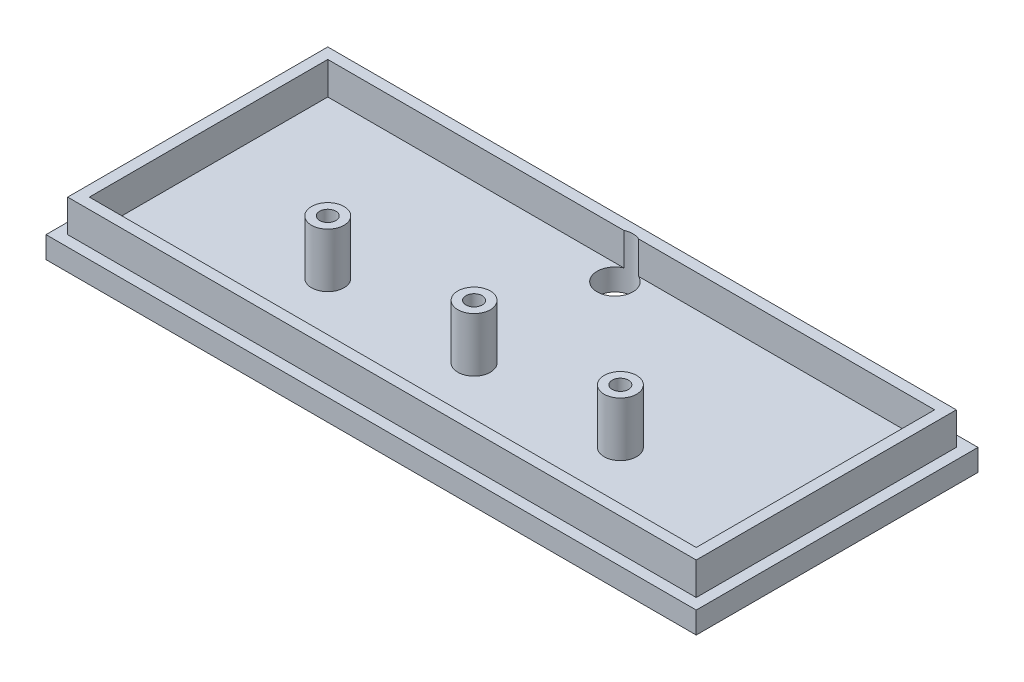
from build123d import *

# Parameters (mm, degrees)
SKETCH1_W                  = 60
SKETCH1_H                  = 26
BOSS_EXTRUDE1_DEPTH        = 2
SKETCH2_W                  = 58
SKETCH2_H                  = 24
SKETCH2_W_2                = 56
SKETCH2_H_2                = 22
BOSS_EXTRUDE2_DEPTH        = 3
SKETCH3_R                  = 1.5
SKETCH3_R_2                = 0.75
BOSS_EXTRUDE3_DEPTH        = 5
F_3_3_3_3_DIAMETER_HOLE1_D = 3.3


with BuildPart() as part:
    # Sketch1 → Boss-Extrude1 (new body)
    with BuildSketch(Plane(origin=(0, 0, 0), x_dir=(1, 0, 0), z_dir=(0, 1, 0))):
        with Locations((30, 13)):
            Rectangle(SKETCH1_W, SKETCH1_H)
    extrude(amount=BOSS_EXTRUDE1_DEPTH)

    # Sketch2 → Boss-Extrude2 (add)
    with BuildSketch(Plane(origin=(0, 2, 0), x_dir=(1, 0, 0), z_dir=(0, 1, 0))):
        with Locations((30, 13)):
            Rectangle(SKETCH2_W, SKETCH2_H)
        with Locations((30, 13)):
            Rectangle(SKETCH2_W_2, SKETCH2_H_2, mode=Mode.SUBTRACT)
    extrude(amount=BOSS_EXTRUDE2_DEPTH)

    # Sketch3 → Boss-Extrude3 (add)
    # profile 1 of 3: a face of its own
    with BuildSketch(Plane(origin=(0, 2, 0), x_dir=(1, 0, 0), z_dir=(0, 1, 0))):
        with Locations((16.5, 9.5)):
            Circle(SKETCH3_R)
        with Locations((16.5, 9.5)):
            Circle(SKETCH3_R_2, mode=Mode.SUBTRACT)
    # profile 2 of 3: a face of its own
    with BuildSketch(Plane(origin=(0, 2, 0), x_dir=(1, 0, 0), z_dir=(0, 1, 0))):
        with Locations((30, 9.5)):
            Circle(SKETCH3_R)
        with Locations((30, 9.5)):
            Circle(SKETCH3_R_2, mode=Mode.SUBTRACT)
    # profile 3 of 3: a face of its own
    with BuildSketch(Plane(origin=(0, 2, 0), x_dir=(1, 0, 0), z_dir=(0, 1, 0))):
        with Locations((43.5, 9.5)):
            Circle(SKETCH3_R)
        with Locations((43.5, 9.5)):
            Circle(SKETCH3_R_2, mode=Mode.SUBTRACT)
    extrude(amount=BOSS_EXTRUDE3_DEPTH)

    # Ø3.3 (3.3) Diameter Hole1 (through all)
    with Locations(Plane(origin=(0, 0, 0), x_dir=(-1, 0, 0), z_dir=(0, -1, 0))):
        with Locations((-30, 22.5)):
            Hole(F_3_3_3_3_DIAMETER_HOLE1_D / 2)


solid = part.part
